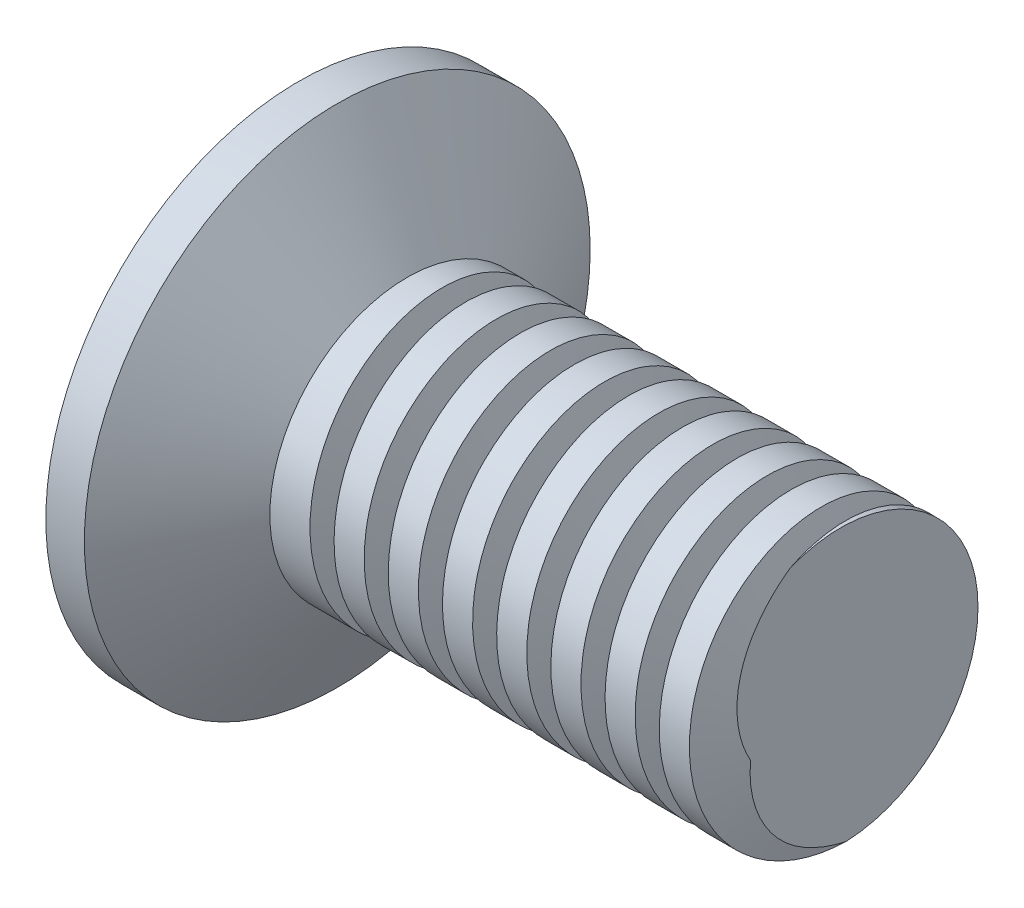
from build123d import *

# Parameters (mm, degrees)
CUT_EXTRUDE1_DEPTH = 0.762
CIRPATTERN1_COUNT  = 6
CUT_SWEEP1_PITCH   = 0.5715


with BuildPart() as part:
    # Sketch1 → Revolve1 (revolve)
    with BuildSketch(Plane.XY, mode=Mode.PRIVATE) as revolve1_sk:
        Polygon((0, 0), (5.715, 0), (5.715, 1.4478), (1.143, 1.4478), (0.4064, 2.667), (0, 2.667), align=None)
    revolve(revolve1_sk.sketch.rotate(Axis((0, 0, 0), (-1, 0, 0)), 90), axis=Axis((0, 0, 0), (-1, 0, 0)))

    # Sketch2 → Cut-Extrude1 (cut)
    with BuildSketch(Plane.ZY):
        Polygon((0, 1.778), (0.513264389, 0.889), (1.539793168, 0.889), (0, 0), align=None)
    cut_extrude1 = extrude(amount=-CUT_EXTRUDE1_DEPTH, mode=Mode.SUBTRACT)

    # CirPattern1: Cut-Extrude1 ×6 about axis
    cirpattern1_axis = Axis((0, 0, 0), (1, 0, 0))
    for i in range(1, CIRPATTERN1_COUNT):
        add(cut_extrude1.rotate(cirpattern1_axis, i * 360 / CIRPATTERN1_COUNT), mode=Mode.SUBTRACT)

    # Cut-Sweep1: arcs per turn and ends read off the stored shape
    # Cut-Sweep1: the profile of Sketch5 profile screwed along a right-hand helix through 8.75 turns, 6 arcs to a turn; built about Z, then put on its axis
    cut_sweep1_z = Axis((0, 0, 0), (0, 0, 1))
    cut_sweep1_corners = [(1.448004946, 5.56e-06, -0.444420005), (1.448004946, 5.56e-06, -0.698580005), (0.971454946, 3.73e-06, -0.571500005)]
    with BuildLine(mode=Mode.PRIVATE) as cut_sweep1_profile:
        Line(cut_sweep1_corners[0], cut_sweep1_corners[1])
        Line(cut_sweep1_corners[1], cut_sweep1_corners[2])
        Line(cut_sweep1_corners[2], cut_sweep1_corners[0])
    cut_sweep1_cap = Face(cut_sweep1_profile.wire())
    cut_sweep1_turn_angles = [0, 30, 60, 90, 120, 150, 180, 210, 240, 270, 300, 330, 360]
    cut_sweep1_turn_weights = [1, 0.8660254037844387, 1, 0.8660254037844387, 1, 0.8660254037844387, 1, 0.8660254037844387, 1, 0.8660254037844387, 1, 0.8660254037844387, 1]
    cut_sweep1_turn_rails = [Edge.make_bspline([Vector(p[0], p[1], 0).rotate(cut_sweep1_z, cut_sweep1_turn_angles[k]) / cut_sweep1_turn_weights[k] + Vector(0, 0, p[2] + CUT_SWEEP1_PITCH * cut_sweep1_turn_angles[k] / 360) for k in range(13)], [0, 0, 0, 1, 1, 2, 2, 3, 3, 4, 4, 5, 5, 6, 6, 6], 2, cut_sweep1_turn_weights) for p in cut_sweep1_corners]
    cut_sweep1_turn_sides = [Face.make_surface_from_curves(cut_sweep1_turn_rails[p[0]], cut_sweep1_turn_rails[p[1]]) for p in [(0, 1), (1, 2), (2, 0)]]
    cut_sweep1_last_angles = [2880, 2910, 2940, 2970, 3000, 3030, 3060, 3090, 3120, 3135, 3150]
    cut_sweep1_last_weights = [1, 0.8660254037844387, 1, 0.8660254037844387, 1, 0.8660254037844387, 1, 0.8660254037844387, 1, 0.9659258262890683, 1]
    cut_sweep1_last_rails = [Edge.make_bspline([Vector(p[0], p[1], 0).rotate(cut_sweep1_z, cut_sweep1_last_angles[k]) / cut_sweep1_last_weights[k] + Vector(0, 0, p[2] + CUT_SWEEP1_PITCH * cut_sweep1_last_angles[k] / 360) for k in range(11)], [0, 0, 0, 1, 1, 2, 2, 3, 3, 4, 4, 5, 5, 5], 2, cut_sweep1_last_weights) for p in cut_sweep1_corners]
    cut_sweep1_last_sides = [Face.make_surface_from_curves(cut_sweep1_last_rails[p[0]], cut_sweep1_last_rails[p[1]]) for p in [(0, 1), (1, 2), (2, 0)]]
    cut_sweep1 = Plane(origin=(5.715, 0, 0), x_dir=(0, -0.2079116908177638, 0.9781476007338047), z_dir=(-1, 0, 0)) * Solid(Shell([*[p.moved(Location((0, 0, CUT_SWEEP1_PITCH * i))) for i in range(8) for p in cut_sweep1_turn_sides], *cut_sweep1_last_sides, cut_sweep1_cap, cut_sweep1_cap.rotate(cut_sweep1_z, 3150).moved(Location((0, 0, CUT_SWEEP1_PITCH * 3150 / 360)))]))
    add(cut_sweep1, mode=Mode.SUBTRACT)


solid = part.part
